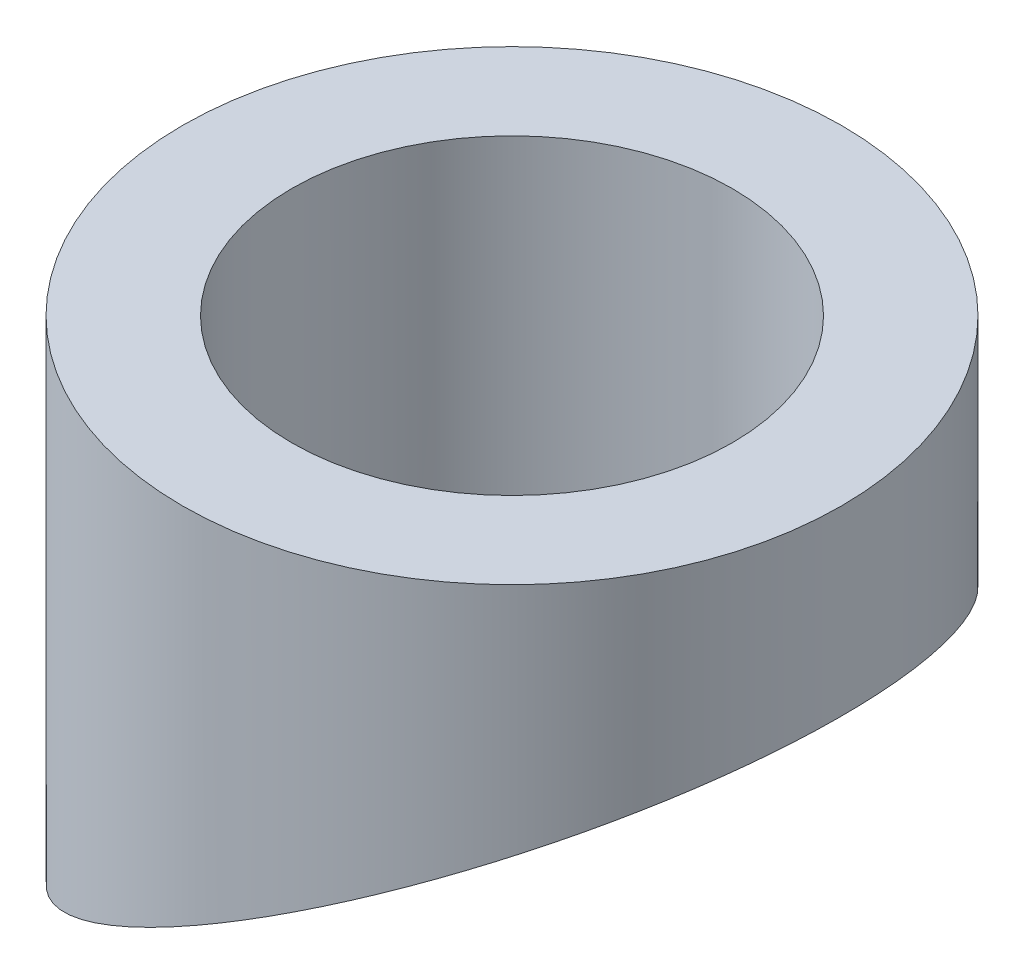
from build123d import *

# Parameters (mm, degrees)
SKETCH1_R           = 9.05
SKETCH1_R_2         = 6.05
BOSS_EXTRUDE1_DEPTH = 15
CUT_EXTRUDE1_DEPTH  = 15


with BuildPart() as part:
    # Sketch1 → Boss-Extrude1 (new body)
    with BuildSketch(Plane(origin=(0, 0, 0), x_dir=(1, 0, 0), z_dir=(0, 1, 0))):
        Circle(SKETCH1_R)
        Circle(SKETCH1_R_2, mode=Mode.SUBTRACT)
    extrude(amount=BOSS_EXTRUDE1_DEPTH)

    # Sketch3 → Cut-Extrude1 (cut, symmetric)
    with BuildSketch(Plane.XY):
        Polygon((-9.05, 0), (9.05, 10), (9.05, 0), align=None)
    extrude(amount=CUT_EXTRUDE1_DEPTH, both=True, mode=Mode.SUBTRACT)


solid = part.part
